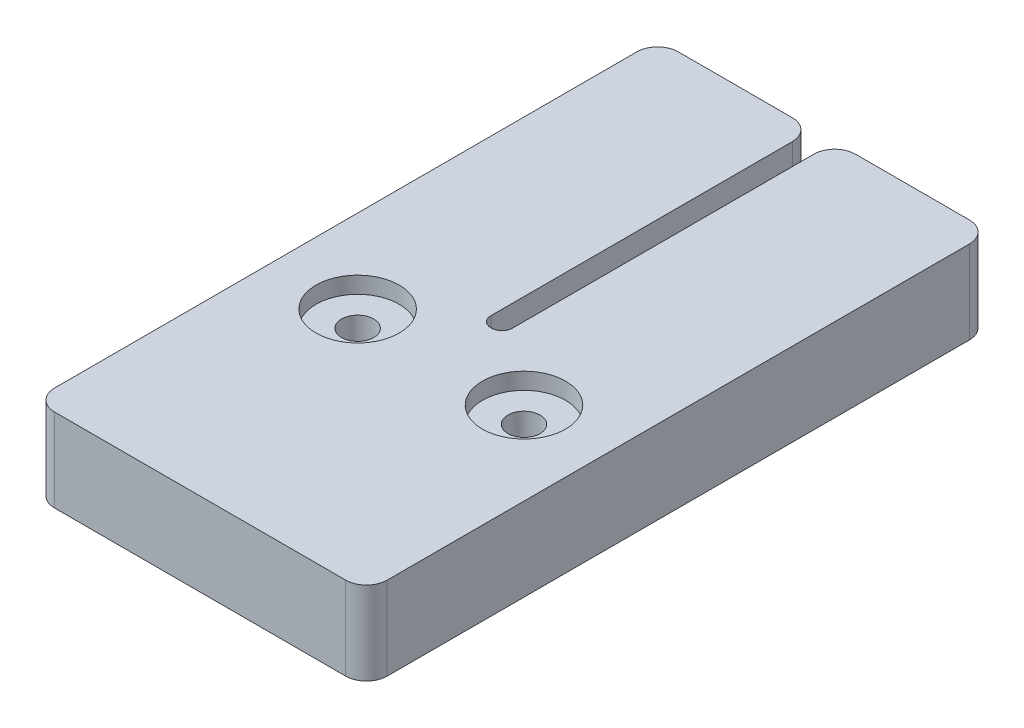
from build123d import *

# Parameters (mm, degrees)
BOSS_EXTRUDE1_DEPTH = 12.7
FILLET1_R           = 3.175
FILLET2_R           = 1.5875
SKETCH2_R           = 2.45745
CUT_EXTRUDE1_DEPTH  = 100.3932216
SKETCH3_R           = 6.35
CUT_EXTRUDE2_DEPTH  = 2.54


with BuildPart() as part:
    # Sketch1 → Boss-Extrude1 (new body)
    with BuildSketch(Plane(origin=(0, 0, 0), x_dir=(1, 0, 0), z_dir=(0, 1, 0))):
        Polygon((-25.4, 0), (25.4, 0), (25.4, 95.25), (1.651, 95.25), (1.651, 44.45), (-1.651, 44.45), (-1.651, 95.25), (-25.4, 95.25), align=None)
    extrude(amount=BOSS_EXTRUDE1_DEPTH)

    # Fillet1
    fillet1_edges = [part.edges().sort_by_distance(p)[0] for p in [
        (1.651, 6.35, -95.25),
        (-1.651, 6.35, -95.25),
        (-25.4, 6.35, -95.25),
        (25.4, 6.35, -95.25),
        (-25.4, 6.35, 0),
        (25.4, 6.35, 0),
    ]]
    fillet(fillet1_edges, radius=FILLET1_R)

    # Fillet2
    fillet2_edges = [part.edges().sort_by_distance(p)[0] for p in [
        (-1.651, 6.35, -44.45),
        (1.651, 6.35, -44.45),
    ]]
    fillet(fillet2_edges, radius=FILLET2_R)

    # Sketch2 → Cut-Extrude1 (cut, through all)
    with BuildSketch(Plane.XZ):
        with Locations((-12.7, -36.7538)):
            Circle(SKETCH2_R)
        with Locations((12.7, -36.7538)):
            Circle(SKETCH2_R)
    extrude(amount=-CUT_EXTRUDE1_DEPTH, mode=Mode.SUBTRACT)

    # Sketch3 → Cut-Extrude2 (cut)
    with BuildSketch(Plane(origin=(0, 12.7, 0), x_dir=(1, 0, 0), z_dir=(0, 1, 0))):
        with Locations((12.7, 36.7538)):
            Circle(SKETCH3_R)
        with Locations((-12.7, 36.7538)):
            Circle(SKETCH3_R)
    extrude(amount=-CUT_EXTRUDE2_DEPTH, mode=Mode.SUBTRACT)


solid = part.part
